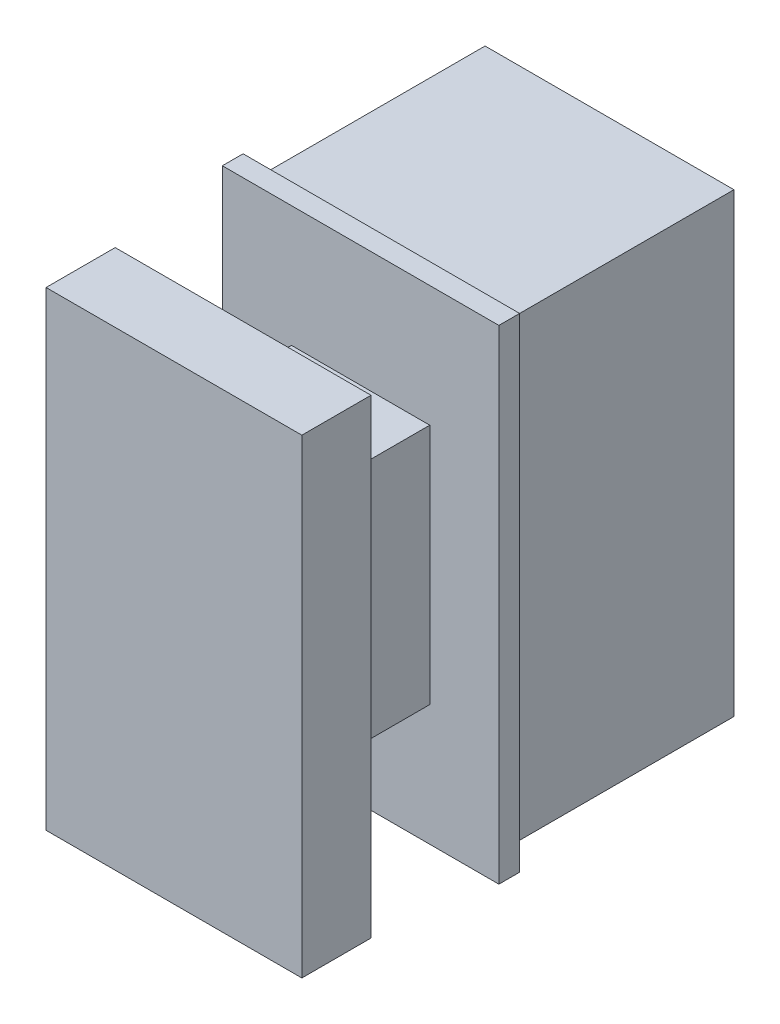
from build123d import *

# Parameters (mm, degrees)
SCHIZZO1_W                   = 4
SCHIZZO1_H                   = 7
ESTRUSIONE_ESTRUSIONE1_DEPTH = 0.3
SCHIZZO2_W                   = 3.6
SCHIZZO2_H                   = 6.6
ESTRUSIONE_ESTRUSIONE2_DEPTH = 3.3
SCHIZZO3_W                   = 3.2
SCHIZZO3_H                   = 6.2
TAGLIO_ESTRUSIONE1_DEPTH     = 9.71148667
SCHIZZO6_W                   = 2
SCHIZZO6_H                   = 3.5
ESTRUSIONE_ESTRUSIONE3_DEPTH = 2
SCHIZZO7_W                   = 3.7
SCHIZZO7_H                   = 6.8
ESTRUSIONE_ESTRUSIONE4_DEPTH = 1


with BuildPart() as part:
    # Schizzo1 → Estrusione-Estrusione1 (new body)
    with BuildSketch(Plane.XY):
        with Locations((2, 3.5)):
            Rectangle(SCHIZZO1_W, SCHIZZO1_H)
    extrude(amount=ESTRUSIONE_ESTRUSIONE1_DEPTH)

    # Schizzo2 → Estrusione-Estrusione2 (add)
    with BuildSketch(Plane.XY):
        with Locations((2, 3.5)):
            Rectangle(SCHIZZO2_W, SCHIZZO2_H)
    extrude(amount=-ESTRUSIONE_ESTRUSIONE2_DEPTH)

    # Schizzo3 → Taglio-Estrusione1 (cut, through all)
    with BuildSketch(Plane.XY):
        with Locations((2, 3.5)):
            Rectangle(SCHIZZO3_W, SCHIZZO3_H)
    extrude(amount=-TAGLIO_ESTRUSIONE1_DEPTH, mode=Mode.SUBTRACT)

    # Schizzo6 → Estrusione-Estrusione3 (add)
    with BuildSketch(Plane.XY):
        with Locations((2, 3.5)):
            Rectangle(SCHIZZO6_W, SCHIZZO6_H)
    extrude(amount=ESTRUSIONE_ESTRUSIONE3_DEPTH)

    # Schizzo7 → Estrusione-Estrusione4 (add)
    with BuildSketch(Plane.XY.offset(2)):
        with Locations((2, 3.5)):
            Rectangle(SCHIZZO7_W, SCHIZZO7_H)
    extrude(amount=ESTRUSIONE_ESTRUSIONE4_DEPTH)


solid = part.part
